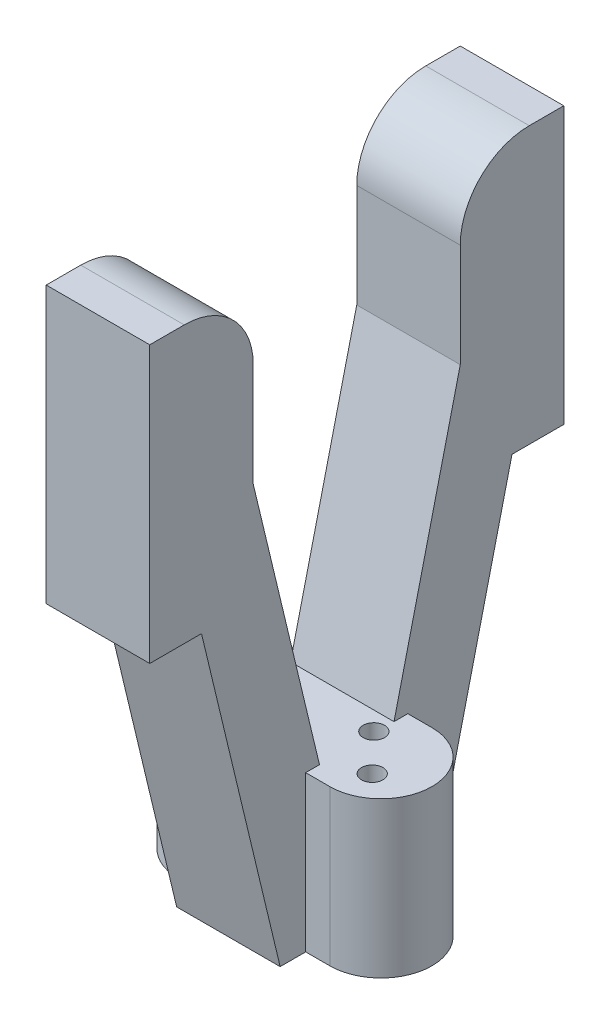
from build123d import *

# Parameters (mm, degrees)
BOSS_EXTRUDE2_DEPTH = 1.5
BOSS_EXTRUDE3_DEPTH = 4.5
SKETCH1_3_R         = 0.63
SKETCH1_3_R_2       = 0.310429465
CUT_EXTRUDE2_DEPTH  = 19.862460073
FILLET1_R           = 2


with BuildPart() as part:
    # Sketch2 → Boss-Extrude2 (new, symmetric)
    with BuildSketch(Plane(origin=(0, 0, 0), x_dir=(0, 0, -1), z_dir=(1, 0, 0))):
        Polygon((-6, 12.5), (-6, 9.5), (-4.5, 9.5), (-2.22, 0), (0, 0), (-3, 12.5), (-3, 17.5), (-6, 17.5), align=None)
    boss_extrude2 = extrude(amount=BOSS_EXTRUDE2_DEPTH, both=True)

    # Sketch1 → Boss-Extrude3 (add)
    with BuildSketch(Plane(origin=(0, 0, 0), x_dir=(1, 0, 0), z_dir=(0, 1, 0))):
        with BuildLine():
            Line((-2.2, 1.48), (2.2, 1.48))
            ThreePointArc((2.2, 1.48), (3.68, 0), (2.2, -1.48))
            Line((2.2, -1.48), (-2.2, -1.48))
            ThreePointArc((-2.2, -1.48), (-3.68, 0), (-2.2, 1.48))
        make_face()
    extrude(amount=BOSS_EXTRUDE3_DEPTH)

    # Mirror1: Boss-Extrude2 across plane
    add(boss_extrude2.mirror(Plane.XY))

    # Sketch1<3> → Cut-Extrude2 (cut, through all)
    with BuildSketch(Plane(origin=(0, 0, 0), x_dir=(1, 0, 0), z_dir=(0, 1, 0))):
        with Locations((-1.210810654, 0)):
            Circle(SKETCH1_3_R)
        with Locations((1.453538454, 0.541981393)):
            Circle(SKETCH1_3_R_2)
        with Locations((2.490372423, -0.541981393)):
            Circle(SKETCH1_3_R_2)
    extrude(amount=CUT_EXTRUDE2_DEPTH, mode=Mode.SUBTRACT)

    # Fillet1
    fillet1_edges = [part.edges().sort_by_distance(p)[0] for p in [
        (0, 17.5, -3),
        (0, 17.5, 3),
    ]]
    fillet(fillet1_edges, radius=FILLET1_R)


solid = part.part
